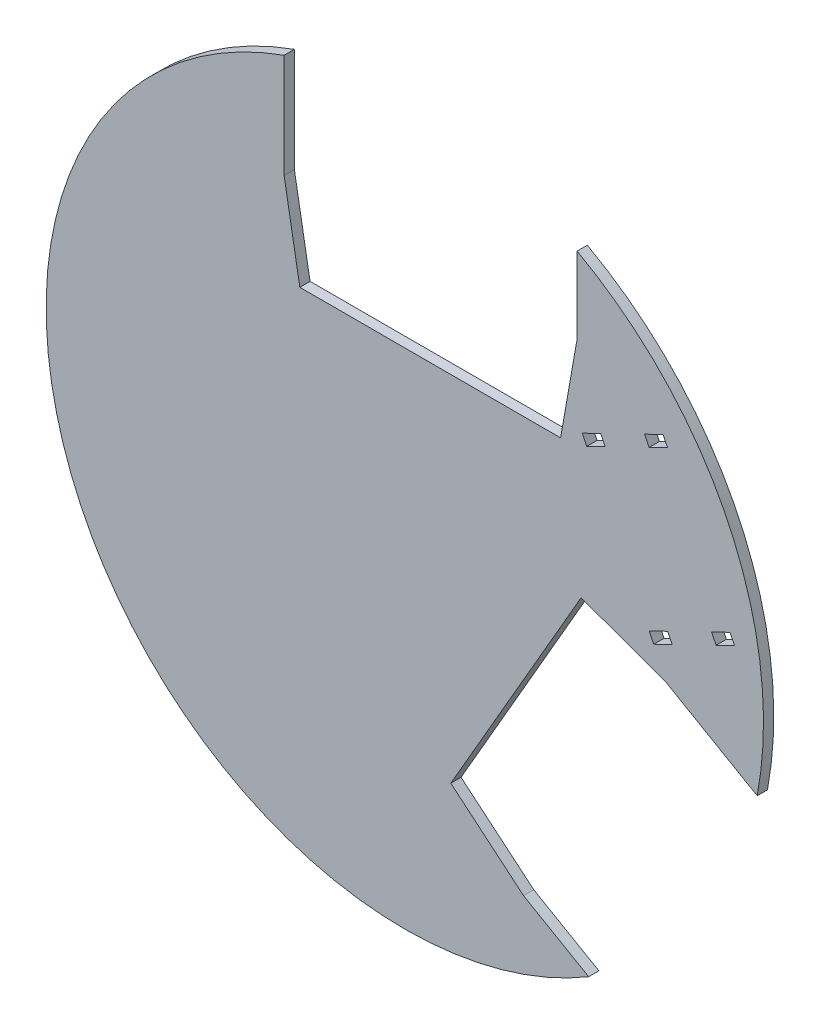
from build123d import *

# Parameters (mm, degrees)
ESQUISSE1_R             = 175
BOSS_EXTRU_1_DEPTH      = 5
ENL_V_MAT_EXTRU_1_DEPTH = 5
ENL_V_MAT_EXTRU_2_DEPTH = 10


with BuildPart() as part:
    # Esquisse1 → Boss.-Extru.1 (new body)
    with BuildSketch(Plane.XY):
        with Locations((0.647080922, 0.314343548)):
            Circle(ESQUISSE1_R)
    extrude(amount=BOSS_EXTRU_1_DEPTH)

    # Esquisse2 → Enlèv. mat.-Extru.1 (cut)
    with BuildSketch(Plane(origin=(0, 0, 0), x_dir=(-1, 0, 0), z_dir=(0, 0, -1))):
        Polygon((58.240826849, 114.332025077), (58.240826849, 213.87663255), (-84.681680643, 213.87663255), (-84.681680643, 116.513512453), (-76.636603499, 70.887612711), (50.580404788, 70.887612711), align=None)
        Polygon((-128.134851608, -6.727976949), (-214.343010489, -56.500280686), (-142.881756743, -180.274802947), (-58.562821347, -131.593242898), (-23.072171671, -101.813051845), (-86.680675815, 8.360109125), align=None)
    extrude(amount=-ENL_V_MAT_EXTRU_1_DEPTH, mode=Mode.SUBTRACT)

    # Esquisse3 → Enlèv. mat.-Extru.2 (cut)
    with BuildSketch(Plane.XY.offset(5)):
        Polygon((122.098140306, 6.413601672), (119.913355624, 10.911013804), (128.908179889, 15.280583169), (131.092964572, 10.783171036), align=None)
        Polygon((159.328821529, 30.058537673), (150.333997264, 25.688968309), (152.518781946, 21.191556176), (161.513606212, 25.561125541), align=None)
        Polygon((126.657541305, 97.312859464), (117.662717039, 92.9432901), (119.847501722, 88.445877967), (128.842325987, 92.815447332), align=None)
        Polygon((96.236899665, 82.53490496), (98.421684347, 78.037492827), (89.426860081, 73.667923463), (87.242075399, 78.165335595), align=None)
    extrude(amount=-ENL_V_MAT_EXTRU_2_DEPTH, mode=Mode.SUBTRACT)


solid = part.part
